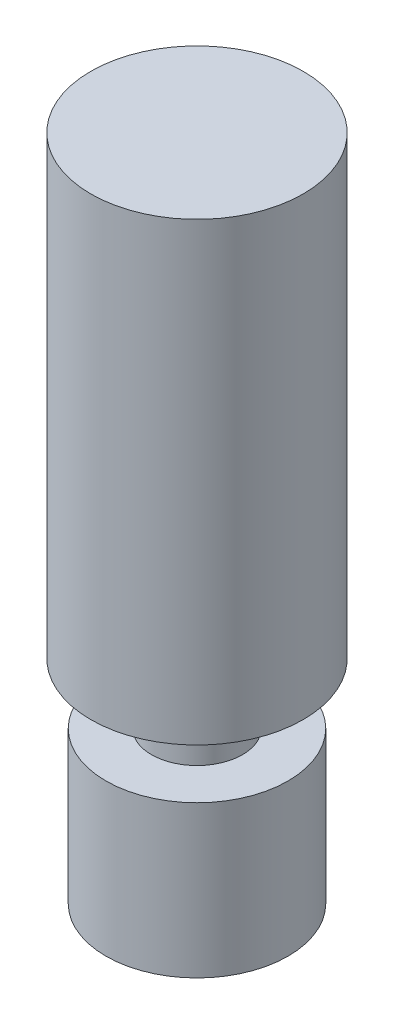
from build123d import *


with BuildPart() as part:
    # Sketch1 → Revolve1 (revolve)
    with BuildSketch(Plane.XY):
        Polygon((0, 22), (3.5, 22), (3.5, 7), (1.5, 7), (1.5, 5), (3, 5), (3, 0), (0, 0), align=None)
    revolve(axis=Axis((0, 0, 0), (0, 1, 0)))


solid = part.part
